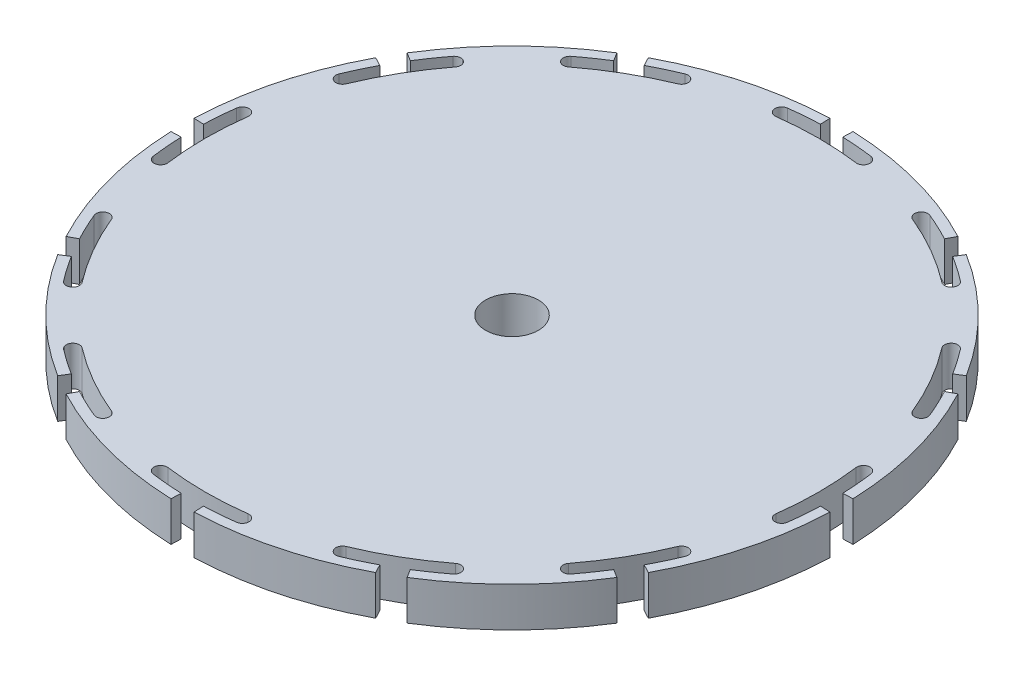
from build123d import *

# Parameters (mm, degrees)
SKETCH1_R         = 50
WHEEL_BLANK_DEPTH = 6
T_SLOT_DEPTH      = 71.964779997
CIRPATTERN_COUNT  = 12
SKETCH3_R         = 4
CENTER_HOLE_DEPTH = 6


with BuildPart() as part:
    # Sketch1 → Wheel Blank (new body)
    with BuildSketch(Plane(origin=(0, 0, 0), x_dir=(1, 0, 0), z_dir=(0, 1, 0))):
        Circle(SKETCH1_R)
    extrude(amount=WHEEL_BLANK_DEPTH)

    # Sketch2 → T-Slot (cut, through all)
    with BuildSketch(Plane(origin=(0, 0, 0), x_dir=(1, 0, 0), z_dir=(0, 1, 0))):
        with BuildLine():
            Line((-1.744974835, 49.969541351), (-1.69262559, 48.47045511))
            ThreePointArc((-1.69262559, 48.47045511), (-4.016198064, 48.333426871), (-6.330520323, 48.085075777))
            ThreePointArc((-6.330520323, 48.085075777), (-7.191438992, 46.963104723), (-6.069467938, 46.102186054))
            ThreePointArc((-6.069467938, 46.102186054), (0, 46.5), (6.069467938, 46.102186054))
            ThreePointArc((6.069467938, 46.102186054), (7.191438992, 46.963104723), (6.330520323, 48.085075777))
            ThreePointArc((6.330520323, 48.085075777), (4.016198064, 48.333426871), (1.69262559, 48.47045511))
            Line((1.69262559, 48.47045511), (1.744974835, 49.969541351))
            ThreePointArc((1.744974835, 49.969541351), (0, 50), (-1.744974835, 49.969541351))
        make_face()
    t_slot = extrude(amount=T_SLOT_DEPTH, mode=Mode.SUBTRACT)

    # CirPattern: T-Slot ×12 about axis
    cirpattern_axis = Axis((0, 6, 0), (0, -1, 0))
    for i in range(1, CIRPATTERN_COUNT):
        add(t_slot.rotate(cirpattern_axis, i * 360 / CIRPATTERN_COUNT), mode=Mode.SUBTRACT)

    # Sketch3 → Center Hole (cut)
    with BuildSketch(Plane(origin=(0, 0, 0), x_dir=(1, 0, 0), z_dir=(0, 1, 0))):
        Circle(SKETCH3_R)
    extrude(amount=CENTER_HOLE_DEPTH, mode=Mode.SUBTRACT)


solid = part.part
